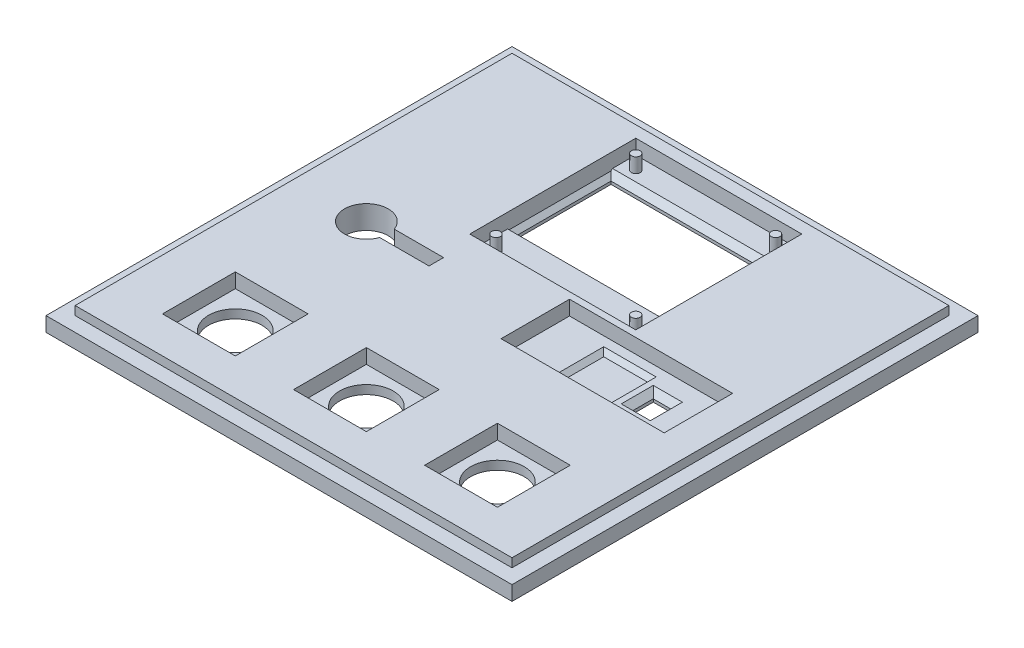
from build123d import *

# Parameters (mm, degrees)
SKETCH1_W           = 80
SKETCH1_H           = 80
SKETCH1_R           = 3.75
SKETCH1_R_2         = 4.596194078
SKETCH1_W_2         = 27
SKETCH1_H_2         = 16
SKETCH1_W_3         = 3
SKETCH1_H_3         = 3.5
BOSS_EXTRUDE1_DEPTH = 2.5
SKETCH2_W           = 75
SKETCH2_H           = 75
SKETCH2_R           = 3.75
SKETCH2_R_2         = 4.596194078
SKETCH2_W_2         = 27
SKETCH2_H_2         = 16
SKETCH2_W_3         = 3
SKETCH2_H_3         = 3.5
BOSS_EXTRUDE2_DEPTH = 1.5
SKETCH3_W           = 28
SKETCH3_H           = 11.75
SKETCH3_W_2         = 12.5
SKETCH3_H_2         = 12.5
SKETCH3_W_3         = 28.5
SKETCH3_H_3         = 28.5
SKETCH3_R           = 0.75
SKETCH3_W_4         = 12
SKETCH3_H_4         = 2.5
CUT_EXTRUDE1_DEPTH  = 2.5
CUT_EXTRUDE2_DEPTH  = 1
CHAMFER1_SIZE       = 1
SKETCH6_W           = 7
SKETCH6_H           = 6.5
CUT_EXTRUDE3_DEPTH  = 0.75
CHAMFER2_SIZE       = 1


with BuildPart() as part:
    # Sketch1 → Boss-Extrude1 (new body)
    with BuildSketch(Plane(origin=(0, 0, 0), x_dir=(1, 0, 0), z_dir=(0, 1, 0))):
        Rectangle(SKETCH1_W, SKETCH1_H)
        with Locations(Location((-25, 0, 0), (0, 0, 270))):
            Circle(SKETCH1_R, mode=Mode.SUBTRACT)
        with Locations(Location((-22.5, -25, 0), (0, 0, 270))):
            Circle(SKETCH1_R_2, mode=Mode.SUBTRACT)
        with Locations(Location((0, -25, 0), (0, 0, 270))):
            Circle(SKETCH1_R_2, mode=Mode.SUBTRACT)
        with Locations(Location((22.5, -25, 0), (0, 0, 270))):
            Circle(SKETCH1_R_2, mode=Mode.SUBTRACT)
        with Locations((0, 22.5)):
            Rectangle(SKETCH1_W_2, SKETCH1_H_2, mode=Mode.SUBTRACT)
        with Locations((24, 0)):
            Rectangle(SKETCH1_W_3, SKETCH1_H_3, mode=Mode.SUBTRACT)
    extrude(amount=BOSS_EXTRUDE1_DEPTH)

    # Sketch2 → Boss-Extrude2 (add)
    with BuildSketch(Plane(origin=(0, 2.5, 0), x_dir=(1, 0, 0), z_dir=(0, 1, 0))):
        Rectangle(SKETCH2_W, SKETCH2_H)
        with Locations(Location((-25, 0, 0), (0, 0, 270))):
            Circle(SKETCH2_R, mode=Mode.SUBTRACT)
        with Locations(Location((-22.5, -25, 0), (0, 0, 270))):
            Circle(SKETCH2_R_2, mode=Mode.SUBTRACT)
        with Locations(Location((0, -25, 0), (0, 0, 270))):
            Circle(SKETCH2_R_2, mode=Mode.SUBTRACT)
        with Locations(Location((22.5, -25, 0), (0, 0, 270))):
            Circle(SKETCH2_R_2, mode=Mode.SUBTRACT)
        with Locations((0, 22.5)):
            Rectangle(SKETCH2_W_2, SKETCH2_H_2, mode=Mode.SUBTRACT)
        with Locations((24, 0)):
            Rectangle(SKETCH2_W_3, SKETCH2_H_3, mode=Mode.SUBTRACT)
    extrude(amount=BOSS_EXTRUDE2_DEPTH)

    # Sketch3 → Cut-Extrude1 (cut)
    # profile 1 of 6: a face of its own
    with BuildSketch(Plane(origin=(0, 4, 0), x_dir=(1, 0, 0), z_dir=(0, 1, 0))):
        with Locations((18, 0)):
            Rectangle(SKETCH3_W, SKETCH3_H)
    # profile 2 of 6: a face of its own
    with BuildSketch(Plane(origin=(0, 4, 0), x_dir=(1, 0, 0), z_dir=(0, 1, 0))):
        with Locations((-22.5, -25)):
            Rectangle(SKETCH3_W_2, SKETCH3_H_2)
    # profile 3 of 6: a face of its own
    with BuildSketch(Plane(origin=(0, 4, 0), x_dir=(1, 0, 0), z_dir=(0, 1, 0))):
        with Locations((0, -25)):
            Rectangle(SKETCH3_W_2, SKETCH3_H_2)
    # profile 4 of 6: a face of its own
    with BuildSketch(Plane(origin=(0, 4, 0), x_dir=(1, 0, 0), z_dir=(0, 1, 0))):
        with Locations((22.5, -25)):
            Rectangle(SKETCH3_W_2, SKETCH3_H_2)
    # profile 5 of 6: a face of its own
    with BuildSketch(Plane(origin=(0, 4, 0), x_dir=(1, 0, 0), z_dir=(0, 1, 0))):
        with Locations((0, 21.25)):
            Rectangle(SKETCH3_W_3, SKETCH3_H_3)
        with Locations(Location((-12, 9.25, 0), (0, 0, 270))):
            Circle(SKETCH3_R, mode=Mode.SUBTRACT)
        with Locations(Location((12, 9.25, 0), (0, 0, 270))):
            Circle(SKETCH3_R, mode=Mode.SUBTRACT)
        with Locations(Location((-12, 33.25, 0), (0, 0, 270))):
            Circle(SKETCH3_R, mode=Mode.SUBTRACT)
        with Locations(Location((12, 33.25, 0), (0, 0, 270))):
            Circle(SKETCH3_R, mode=Mode.SUBTRACT)
    # profile 6 of 6: a face of its own
    with BuildSketch(Plane(origin=(0, 4, 0), x_dir=(1, 0, 0), z_dir=(0, 1, 0))):
        with Locations((-19, 0)):
            Rectangle(SKETCH3_W_4, SKETCH3_H_4)
    extrude(amount=-CUT_EXTRUDE1_DEPTH, mode=Mode.SUBTRACT)

    # Sketch5 → Cut-Extrude2 (cut)
    # profile 1 of 5: a face of its own
    with BuildSketch(Plane.XZ):
        with BuildLine():
            Line((-15.314102564, -2.557692308), (-15.942307692, -2.557692308))
            Line((-15.942307692, -2.557692308), (-15.942307692, -2.287059295))
            add(Edge.make_bspline(
                [(-15.942307692, -2.287059295), (-15.978134031, -2.314958038), (-16.046605128, -2.368277961), (-16.150986474, -2.435975666), (-16.248840247, -2.492583724), (-16.343712499, -2.534614816), (-16.436313118, -2.565395384), (-16.528921348, -2.586075922), (-16.62218654, -2.600367954), (-16.684976457, -2.601832446), (-16.716346154, -2.602564103)],
                knots=[0, 0, 0, 0, 1.276368674, 2.439388659, 3.495912974, 4.452193402, 5.352134101, 6.235408687, 7.118414254, 8, 8, 8, 8], degree=3))
            add(Edge.make_bspline(
                [(-16.716346154, -2.602564103), (-16.748178142, -2.601809409), (-16.810698204, -2.600327142), (-16.902404818, -2.587043105), (-16.99057064, -2.567039103), (-17.07513869, -2.538068223), (-17.15621812, -2.500755276), (-17.233306129, -2.454929083), (-17.307134386, -2.401512942), (-17.351969159, -2.359992411), (-17.374699519, -2.338942308)],
                knots=[0, 0, 0, 0, 1.049021809, 2.060345963, 3.049166385, 4.026358373, 5.002121295, 5.98669893, 6.979295433, 8, 8, 8, 8], degree=3))
            add(Edge.make_bspline(
                [(-17.374699519, -2.338942308), (-17.392972531, -2.319502791), (-17.42965229, -2.280481484), (-17.475774893, -2.21369225), (-17.515598123, -2.140745861), (-17.547550669, -2.060898672), (-17.571982399, -1.974090325), (-17.590246783, -1.881055684), (-17.600637768, -1.781085742), (-17.601910024, -1.712396906), (-17.602564103, -1.677083333)],
                knots=[0, 0, 0, 0, 0.889614892, 1.785740703, 2.700456201, 3.659579934, 4.649837014, 5.707163549, 6.821231365, 8, 8, 8, 8], degree=3))
            Line((-17.602564103, -1.677083333), (-17.602564103, 0))
            Line((-17.602564103, 0), (-16.974358974, 0))
            Line((-16.974358974, 0), (-16.974358974, -1.110576923))
            add(Edge.make_bspline(
                [(-16.974358974, -1.110576923), (-16.974226188, -1.14680202), (-16.973971729, -1.216220696), (-16.972016224, -1.315569051), (-16.968202384, -1.405294212), (-16.964714871, -1.485556568), (-16.95791194, -1.55608045), (-16.951647107, -1.617512877), (-16.942370319, -1.669148113), (-16.929936208, -1.724588981), (-16.90880149, -1.783718085), (-16.874626157, -1.845301855), (-16.833914764, -1.899274805), (-16.783944009, -1.942854804), (-16.727377165, -1.978137551), (-16.663470588, -2.001153711), (-16.594171646, -2.016847932), (-16.545835494, -2.018416281), (-16.520733173, -2.019230769)],
                knots=[0, 0, 0, 0, 1.498094087, 2.87081926, 4.108872756, 5.212198849, 6.192223846, 7.038608387, 7.76476505, 8.360237201, 9.387450647, 10.347786011, 11.264120523, 12.167881173, 13.074582735, 14.004426592, 14.963642712, 16, 16, 16, 16], degree=3))
            add(Edge.make_bspline(
                [(-16.520733173, -2.019230769), (-16.488116509, -2.017536931), (-16.424085854, -2.014211711), (-16.331564274, -1.990284891), (-16.247268941, -1.948098182), (-16.170368906, -1.891760394), (-16.102754082, -1.820620125), (-16.047460403, -1.735567725), (-16.001536006, -1.639279009), (-15.981912792, -1.569021262), (-15.971754808, -1.532652244)],
                knots=[0, 0, 0, 0, 0.983921966, 1.931563801, 2.858832989, 3.812360937, 4.795068995, 5.802394485, 6.86240651, 8, 8, 8, 8], degree=3))
            add(Edge.make_bspline(
                [(-15.971754808, -1.532652244), (-15.969230168, -1.521232268), (-15.963599715, -1.495763426), (-15.958903521, -1.452740988), (-15.952725138, -1.40142979), (-15.94892552, -1.341519455), (-15.946256799, -1.272787523), (-15.944218898, -1.195655081), (-15.942812408, -1.109646938), (-15.942481504, -1.049579945), (-15.942307692, -1.018028846)],
                knots=[0, 0, 0, 0, 0.543349587, 1.211778823, 2.009659055, 2.946304759, 4.001087888, 5.207523181, 6.533209197, 8, 8, 8, 8], degree=3))
            Line((-15.942307692, -1.018028846), (-15.942307692, 0))
            Line((-15.942307692, 0), (-15.314102564, 0))
            Line((-15.314102564, 0), (-15.314102564, -2.557692308))
        make_face()
    # profile 2 of 5: a face of its own
    with BuildSketch(Plane.XZ):
        with BuildLine():
            add(Edge.make_bspline(
                [(-12.785857372, -3.58974359), (-12.846709465, -3.588168661), (-12.966845279, -3.585059395), (-13.143516451, -3.559121692), (-13.31379221, -3.516908566), (-13.477696964, -3.457985839), (-13.634671717, -3.381675624), (-13.785293236, -3.289020183), (-13.929148756, -3.179233296), (-14.064561067, -3.053881628), (-14.188730842, -2.916813501), (-14.297877484, -2.770679131), (-14.390529149, -2.616987295), (-14.465734729, -2.455708046), (-14.524464863, -2.287062919), (-14.565281616, -2.110987913), (-14.59159929, -1.927708499), (-14.594619093, -1.802909648), (-14.596153846, -1.739483173)],
                knots=[0, 0, 0, 0, 1.014151002, 2.002163778, 2.969868608, 3.93493411, 4.9003771, 5.874719092, 6.87846472, 7.912488755, 8.947011879, 9.957751389, 10.948740761, 11.933621513, 12.919426746, 13.920294397, 14.943031967, 16, 16, 16, 16], degree=3))
            add(Edge.make_bspline(
                [(-14.596153846, -1.739483173), (-14.594518884, -1.676771488), (-14.591297139, -1.553196101), (-14.566359201, -1.37160396), (-14.524833041, -1.197421404), (-14.467235154, -1.030588885), (-14.393344559, -0.871103667), (-14.302107864, -0.719483262), (-14.194124498, -0.575416136), (-14.071600255, -0.4397849), (-13.93754387, -0.315871291), (-13.794709216, -0.207090364), (-13.6444233, -0.115595563), (-13.487646322, -0.039652914), (-13.32289927, 0.017415825), (-13.152008681, 0.060131946), (-12.973545007, 0.084832759), (-12.852304558, 0.088090183), (-12.790765224, 0.08974359)],
                knots=[0, 0, 0, 0, 1.051517626, 2.07204922, 3.067438659, 4.05042616, 5.027204762, 6.009981242, 7.012629434, 8.042243656, 9.071350414, 10.070091277, 11.048190212, 12.017682766, 12.985867053, 13.966945899, 14.968060614, 16, 16, 16, 16], degree=3))
            add(Edge.make_bspline(
                [(-12.790765224, 0.08974359), (-12.726397479, 0.08827779), (-12.599923657, 0.085397695), (-12.414782707, 0.058240346), (-12.237654486, 0.016835351), (-12.069024328, -0.043109119), (-11.909023326, -0.120998612), (-11.756933941, -0.215044231), (-11.613900023, -0.327062596), (-11.480398344, -0.453675043), (-11.359459588, -0.592252759), (-11.252703732, -0.738638503), (-11.162653723, -0.891725246), (-11.089304937, -1.051581713), (-11.031479761, -1.217215196), (-10.990690654, -1.38963425), (-10.966595559, -1.568425406), (-10.963239252, -1.689863931), (-10.961538462, -1.751402244)],
                knots=[0, 0, 0, 0, 1.067953136, 2.098381936, 3.099641766, 4.083805132, 5.062469929, 6.048665414, 7.046702845, 8.073106546, 9.098695993, 10.09591865, 11.076726721, 12.041940862, 13.011263376, 13.984305721, 14.978557872, 16, 16, 16, 16], degree=3))
            add(Edge.make_bspline(
                [(-10.961538462, -1.751402244), (-10.962079632, -1.792800204), (-10.963155121, -1.875071932), (-10.975826061, -1.99702608), (-10.994618614, -2.116425047), (-11.020345168, -2.233493361), (-11.055007391, -2.347929328), (-11.097136507, -2.460021607), (-11.146230207, -2.569769578), (-11.202843778, -2.676180726), (-11.266885023, -2.777981899), (-11.335263794, -2.876062234), (-11.410599142, -2.967846929), (-11.491336112, -3.054332991), (-11.577790944, -3.135125073), (-11.670114208, -3.210499044), (-11.768160591, -3.28026266), (-11.870869588, -3.344992407), (-11.977889857, -3.40168561), (-12.086675185, -3.453073846), (-12.198269896, -3.494739415), (-12.311863739, -3.529248151), (-12.427195551, -3.556942813), (-12.545155794, -3.575357402), (-12.664748912, -3.588128444), (-12.74539208, -3.58920393), (-12.785857372, -3.58974359)],
                knots=[0, 0, 0, 0, 1.034641744, 2.056182551, 3.061960284, 4.05571729, 5.050247014, 6.048716841, 7.047801973, 8.054190544, 9.059424999, 10.053182006, 11.041513076, 12.025412457, 13.009311837, 13.997642908, 15.002928308, 16.016213968, 17.030509951, 18.02913364, 19.022134519, 20.005478534, 20.996155877, 21.984625117, 22.988721131, 24, 24, 24, 24], degree=3))
        make_face()
        with BuildLine():
            add(Edge.make_bspline(
                [(-12.776041667, -2.961538462), (-12.735088422, -2.960439593), (-12.654263106, -2.958270865), (-12.535707053, -2.941748135), (-12.421889185, -2.915359354), (-12.313439829, -2.877135893), (-12.209891216, -2.828485819), (-12.111051332, -2.769585006), (-12.018320954, -2.69838629), (-11.930339991, -2.618797241), (-11.851131694, -2.529750419), (-11.779912706, -2.435361289), (-11.722329264, -2.333358687), (-11.672815725, -2.227102306), (-11.636242317, -2.113905032), (-11.608395482, -1.995604049), (-11.593228255, -1.870984913), (-11.590921693, -1.786262006), (-11.58974359, -1.742988782)],
                knots=[0, 0, 0, 0, 1.033668485, 2.040047952, 3.016132939, 3.979056467, 4.937231767, 5.900589077, 6.877725736, 7.88429546, 8.891280164, 9.882584218, 10.863295226, 11.842887319, 12.837417301, 13.860812229, 14.907384602, 16, 16, 16, 16], degree=3))
            add(Edge.make_bspline(
                [(-11.58974359, -1.742988782), (-11.591175632, -1.695018961), (-11.593982198, -1.601006059), (-11.613442255, -1.463789053), (-11.647540066, -1.334350302), (-11.694121786, -1.21225679), (-11.756042178, -1.0987924), (-11.830100365, -0.992581566), (-11.918150602, -0.894283273), (-11.985864586, -0.836844817), (-12.020232372, -0.807692308)],
                knots=[0, 0, 0, 0, 1.078343132, 2.113373867, 3.107373148, 4.082093053, 5.043582658, 6.005574554, 6.987742499, 8, 8, 8, 8], degree=3))
            add(Edge.make_bspline(
                [(-12.020232372, -0.807692308), (-12.04839365, -0.786158968), (-12.104081729, -0.743577439), (-12.192972027, -0.689000474), (-12.28451153, -0.642222571), (-12.37939102, -0.604426578), (-12.477410114, -0.574696886), (-12.578555373, -0.553877671), (-12.682683481, -0.540811814), (-12.753099788, -0.539250196), (-12.788661859, -0.538461538)],
                knots=[0, 0, 0, 0, 1.023928204, 2.024787132, 3.009472467, 3.9914905, 4.972207045, 5.96565515, 6.972602802, 8, 8, 8, 8], degree=3))
            add(Edge.make_bspline(
                [(-12.788661859, -0.538461538), (-12.828910132, -0.539571297), (-12.908099876, -0.541754781), (-13.024460068, -0.558051655), (-13.135884959, -0.585752546), (-13.243407338, -0.623369353), (-13.3455874, -0.67378239), (-13.444018568, -0.733644005), (-13.537527711, -0.804821153), (-13.624974892, -0.886415912), (-13.705115559, -0.975466934), (-13.776017746, -1.070366605), (-13.834736446, -1.17111862), (-13.883715316, -1.276377149), (-13.921875309, -1.38698027), (-13.94799029, -1.502936326), (-13.964773888, -1.623777487), (-13.966877208, -1.706006218), (-13.967948718, -1.747896635)],
                knots=[0, 0, 0, 0, 1.026350473, 2.019376834, 2.989435443, 3.95094063, 4.91865229, 5.889827372, 6.885283771, 7.910196595, 8.935871797, 9.9372888, 10.925850568, 11.904605667, 12.894245083, 13.903507864, 14.931967858, 16, 16, 16, 16], degree=3))
            add(Edge.make_bspline(
                [(-13.967948718, -1.747896635), (-13.966844284, -1.789547888), (-13.964670375, -1.871532028), (-13.948282174, -1.992037961), (-13.921037347, -2.107356876), (-13.882531699, -2.217786038), (-13.834561674, -2.32390519), (-13.774303337, -2.42479331), (-13.703062818, -2.520363111), (-13.622142452, -2.610046419), (-13.534080095, -2.692465159), (-13.439532536, -2.763988235), (-13.341149846, -2.826139881), (-13.236673462, -2.874826882), (-13.12824119, -2.913615736), (-13.01519129, -2.942180398), (-12.897095598, -2.958154796), (-12.816752657, -2.960400519), (-12.776041667, -2.961538462)],
                knots=[0, 0, 0, 0, 1.055040155, 2.076685641, 3.074845078, 4.052329834, 5.035358467, 6.020382375, 7.023447318, 8.050688466, 9.077178457, 10.074336316, 11.0503314, 12.019748348, 12.988025369, 13.964577102, 14.968620271, 16, 16, 16, 16], degree=3))
        make_face(mode=Mode.SUBTRACT)
    # profile 3 of 5: a face of its own
    with BuildSketch(Plane.XZ):
        with BuildLine():
            Line((-25, 7.442307692), (-25.224358974, 7.442307692))
            add(Edge.make_bspline(
                [(-25.224358974, 7.442307692), (-25.224508908, 7.401641821), (-25.224792412, 7.324748186), (-25.226466739, 7.215845408), (-25.22759582, 7.120016025), (-25.229612608, 7.037274777), (-25.232451022, 6.967864027), (-25.235360696, 6.911787569), (-25.237540238, 6.868691593), (-25.240613101, 6.844474699), (-25.241887019, 6.834435096)],
                knots=[0, 0, 0, 0, 1.604323161, 3.033556972, 4.296844687, 5.385167547, 6.298701784, 7.037230881, 7.60086462, 8, 8, 8, 8], degree=3))
            add(Edge.make_bspline(
                [(-25.241887019, 6.834435096), (-25.247860573, 6.799990486), (-25.25950505, 6.732846283), (-25.298052031, 6.639260863), (-25.354063902, 6.557737247), (-25.413439923, 6.500193569), (-25.468466273, 6.460909957), (-25.514628808, 6.435252425), (-25.564822153, 6.413256076), (-25.619208482, 6.396008303), (-25.677270544, 6.381919077), (-25.73963493, 6.372124946), (-25.805959488, 6.366727521), (-25.851619688, 6.365839385), (-25.875, 6.365384615)],
                knots=[0, 0, 0, 0, 1.43722947, 2.801646624, 4.13175475, 5.486897933, 6.18427957, 6.91287343, 7.658885333, 8.438447905, 9.260561323, 10.118602268, 11.036630026, 12, 12, 12, 12], degree=3))
            add(Edge.make_bspline(
                [(-25.875, 6.365384615), (-25.910825312, 6.36648546), (-25.985211087, 6.368771196), (-26.09979743, 6.387835353), (-26.221483496, 6.416335542), (-26.303569163, 6.443262376), (-26.346153846, 6.457231571)],
                knots=[0, 0, 0, 0, 0.891295899, 1.85063944, 2.884947376, 4, 4, 4, 4], degree=3))
            Line((-26.346153846, 6.457231571), (-26.346153846, 6.945913462))
            add(Edge.make_bspline(
                [(-26.346153846, 6.945913462), (-26.323310362, 6.939597623), (-26.279742732, 6.927551908), (-26.217055815, 6.914180094), (-26.160573002, 6.905923032), (-26.125089225, 6.904508516), (-26.108473558, 6.903846154)],
                knots=[0, 0, 0, 0, 1.174725213, 2.24046353, 3.176077791, 4, 4, 4, 4], degree=3))
            add(Edge.make_bspline(
                [(-26.108473558, 6.903846154), (-26.090157753, 6.904111672), (-26.055790437, 6.904609885), (-26.008686118, 6.915266025), (-25.967606159, 6.928427809), (-25.946633026, 6.945050865), (-25.936698718, 6.952924679)],
                knots=[0, 0, 0, 0, 1.200739268, 2.253036902, 3.172518975, 4, 4, 4, 4], degree=3))
            add(Edge.make_bspline(
                [(-25.936698718, 6.952924679), (-25.930324371, 6.960569078), (-25.916400842, 6.97726679), (-25.905774682, 7.012637512), (-25.897849275, 7.056060741), (-25.897582077, 7.088644446), (-25.897435897, 7.106470353)],
                knots=[0, 0, 0, 0, 0.730107156, 1.594778094, 2.684150175, 4, 4, 4, 4], degree=3))
            Line((-25.897435897, 7.106470353), (-25.895332532, 7.442307692))
            Line((-25.895332532, 7.442307692), (-26.301282051, 7.442307692))
            Line((-26.301282051, 7.442307692), (-26.301282051, 7.980769231))
            Line((-26.301282051, 7.980769231), (-25.852564103, 7.980769231))
            Line((-25.852564103, 7.980769231), (-25.852564103, 10))
            Line((-25.852564103, 10), (-25.224358974, 10))
            Line((-25.224358974, 10), (-25.224358974, 7.980769231))
            Line((-25.224358974, 7.980769231), (-25, 7.980769231))
            Line((-25, 7.980769231), (-25, 7.442307692))
        make_face()
    # profile 4 of 5: a face of its own
    with BuildSketch(Plane.XZ):
        with BuildLine():
            Line((-23.653846154, 7.442307692), (-23.878205128, 7.442307692))
            add(Edge.make_bspline(
                [(-23.878205128, 7.442307692), (-23.878355062, 7.401641821), (-23.878638566, 7.324748186), (-23.880312893, 7.215845408), (-23.881441974, 7.120016025), (-23.883458762, 7.037274777), (-23.886297176, 6.967864027), (-23.88920685, 6.911787569), (-23.891386391, 6.868691593), (-23.894459255, 6.844474699), (-23.895733173, 6.834435096)],
                knots=[0, 0, 0, 0, 1.604323161, 3.033556972, 4.296844687, 5.385167547, 6.298701784, 7.037230881, 7.60086462, 8, 8, 8, 8], degree=3))
            add(Edge.make_bspline(
                [(-23.895733173, 6.834435096), (-23.901706727, 6.799990486), (-23.913351204, 6.732846283), (-23.951898185, 6.639260863), (-24.007910056, 6.557737247), (-24.067286077, 6.500193569), (-24.122312427, 6.460909957), (-24.168474962, 6.435252425), (-24.218668307, 6.413256076), (-24.273054636, 6.396008303), (-24.331116698, 6.381919077), (-24.393481084, 6.372124946), (-24.459805642, 6.366727521), (-24.505465842, 6.365839385), (-24.528846154, 6.365384615)],
                knots=[0, 0, 0, 0, 1.43722947, 2.801646624, 4.13175475, 5.486897933, 6.18427957, 6.91287343, 7.658885333, 8.438447905, 9.260561323, 10.118602268, 11.036630026, 12, 12, 12, 12], degree=3))
            add(Edge.make_bspline(
                [(-24.528846154, 6.365384615), (-24.564671466, 6.36648546), (-24.639057241, 6.368771196), (-24.753643583, 6.387835353), (-24.87532965, 6.416335542), (-24.957415317, 6.443262376), (-25, 6.457231571)],
                knots=[0, 0, 0, 0, 0.891295899, 1.85063944, 2.884947376, 4, 4, 4, 4], degree=3))
            Line((-25, 6.457231571), (-25, 6.945913462))
            add(Edge.make_bspline(
                [(-25, 6.945913462), (-24.977156516, 6.939597623), (-24.933588886, 6.927551908), (-24.870901969, 6.914180094), (-24.814419156, 6.905923032), (-24.778935379, 6.904508516), (-24.762319712, 6.903846154)],
                knots=[0, 0, 0, 0, 1.174725213, 2.24046353, 3.176077791, 4, 4, 4, 4], degree=3))
            add(Edge.make_bspline(
                [(-24.762319712, 6.903846154), (-24.744003906, 6.904111672), (-24.709636591, 6.904609885), (-24.662532272, 6.915266025), (-24.621452313, 6.928427809), (-24.60047918, 6.945050865), (-24.590544872, 6.952924679)],
                knots=[0, 0, 0, 0, 1.200739268, 2.253036902, 3.172518975, 4, 4, 4, 4], degree=3))
            add(Edge.make_bspline(
                [(-24.590544872, 6.952924679), (-24.584170525, 6.960569078), (-24.570246996, 6.97726679), (-24.559620836, 7.012637512), (-24.551695429, 7.056060741), (-24.55142823, 7.088644446), (-24.551282051, 7.106470353)],
                knots=[0, 0, 0, 0, 0.730107156, 1.594778094, 2.684150175, 4, 4, 4, 4], degree=3))
            Line((-24.551282051, 7.106470353), (-24.549178686, 7.442307692))
            Line((-24.549178686, 7.442307692), (-24.955128205, 7.442307692))
            Line((-24.955128205, 7.442307692), (-24.955128205, 7.980769231))
            Line((-24.955128205, 7.980769231), (-24.506410256, 7.980769231))
            Line((-24.506410256, 7.980769231), (-24.506410256, 10))
            Line((-24.506410256, 10), (-23.878205128, 10))
            Line((-23.878205128, 10), (-23.878205128, 7.980769231))
            Line((-23.878205128, 7.980769231), (-23.653846154, 7.980769231))
            Line((-23.653846154, 7.980769231), (-23.653846154, 7.442307692))
        make_face()
    # profile 5 of 5: a face of its own
    with BuildSketch(Plane.XZ):
        with BuildLine():
            add(Edge.make_bspline(
                [(-21.6640625, 6.41025641), (-21.724914593, 6.411831339), (-21.845050408, 6.414940605), (-22.021721579, 6.440878308), (-22.191997338, 6.483091434), (-22.355902092, 6.542014161), (-22.512876845, 6.618324376), (-22.663498364, 6.710979817), (-22.807353884, 6.820766704), (-22.942766196, 6.946118372), (-23.06693597, 7.083186499), (-23.176082613, 7.229320869), (-23.268734277, 7.383012705), (-23.343939857, 7.544291954), (-23.402669991, 7.712937081), (-23.443486744, 7.889012087), (-23.469804418, 8.072291501), (-23.472824221, 8.197090352), (-23.474358974, 8.260516827)],
                knots=[0, 0, 0, 0, 1.014151002, 2.002163778, 2.969868608, 3.93493411, 4.9003771, 5.874719092, 6.87846472, 7.912488755, 8.947011879, 9.957751389, 10.948740761, 11.933621513, 12.919426746, 13.920294397, 14.943031967, 16, 16, 16, 16], degree=3))
            add(Edge.make_bspline(
                [(-23.474358974, 8.260516827), (-23.472724012, 8.323228512), (-23.469502267, 8.446803899), (-23.444564329, 8.62839604), (-23.403038169, 8.802578596), (-23.345440282, 8.969411115), (-23.271549687, 9.128896333), (-23.180312992, 9.280516738), (-23.072329626, 9.424583864), (-22.949805383, 9.5602151), (-22.815748999, 9.684128709), (-22.672914344, 9.792909636), (-22.522628428, 9.884404437), (-22.36585145, 9.960347086), (-22.201104398, 10.017415825), (-22.030213809, 10.060131946), (-21.851750135, 10.084832759), (-21.730509686, 10.088090183), (-21.668970353, 10.08974359)],
                knots=[0, 0, 0, 0, 1.051517626, 2.07204922, 3.067438659, 4.05042616, 5.027204762, 6.009981242, 7.012629434, 8.042243656, 9.071350414, 10.070091277, 11.048190212, 12.017682766, 12.985867053, 13.966945899, 14.968060614, 16, 16, 16, 16], degree=3))
            add(Edge.make_bspline(
                [(-21.668970353, 10.08974359), (-21.604602607, 10.08827779), (-21.478128785, 10.085397695), (-21.292987836, 10.058240346), (-21.115859614, 10.016835351), (-20.947229457, 9.956890881), (-20.787228454, 9.879001388), (-20.63513907, 9.784955769), (-20.492105151, 9.672937404), (-20.358603472, 9.546324957), (-20.237664716, 9.407747241), (-20.13090886, 9.261361497), (-20.040858851, 9.108274754), (-19.967510065, 8.948418287), (-19.909684889, 8.782784804), (-19.868895782, 8.61036575), (-19.844800687, 8.431574594), (-19.84144438, 8.310136069), (-19.83974359, 8.248597756)],
                knots=[0, 0, 0, 0, 1.067953136, 2.098381936, 3.099641766, 4.083805132, 5.062469929, 6.048665414, 7.046702845, 8.073106546, 9.098695993, 10.09591865, 11.076726721, 12.041940862, 13.011263376, 13.984305721, 14.978557872, 16, 16, 16, 16], degree=3))
            add(Edge.make_bspline(
                [(-19.83974359, 8.248597756), (-19.84028476, 8.207199796), (-19.841360249, 8.124928068), (-19.854031189, 8.00297392), (-19.872823742, 7.883574953), (-19.898550296, 7.766506639), (-19.933212519, 7.652070672), (-19.975341635, 7.539978393), (-20.024435335, 7.430230422), (-20.081048907, 7.323819274), (-20.145090152, 7.222018101), (-20.213468923, 7.123937766), (-20.28880427, 7.032153071), (-20.36954124, 6.945667009), (-20.455996072, 6.864874927), (-20.548319337, 6.789500956), (-20.646365719, 6.71973734), (-20.749074716, 6.655007593), (-20.856094985, 6.59831439), (-20.964880313, 6.546926154), (-21.076475025, 6.505260585), (-21.190068867, 6.470751849), (-21.305400679, 6.443057187), (-21.423360923, 6.424642598), (-21.54295404, 6.411871556), (-21.623597208, 6.41079607), (-21.6640625, 6.41025641)],
                knots=[0, 0, 0, 0, 1.034641744, 2.056182551, 3.061960284, 4.05571729, 5.050247014, 6.048716841, 7.047801973, 8.054190544, 9.059424999, 10.053182006, 11.041513076, 12.025412457, 13.009311837, 13.997642908, 15.002928308, 16.016213968, 17.030509951, 18.02913364, 19.022134519, 20.005478534, 20.996155877, 21.984625117, 22.988721131, 24, 24, 24, 24], degree=3))
        make_face()
        with BuildLine():
            add(Edge.make_bspline(
                [(-21.654246795, 7.038461538), (-21.613293551, 7.039560407), (-21.532468234, 7.041729135), (-21.413912181, 7.058251865), (-21.300094313, 7.084640646), (-21.191644958, 7.122864107), (-21.088096344, 7.171514181), (-20.98925646, 7.230414994), (-20.896526082, 7.30161371), (-20.808545119, 7.381202759), (-20.729336823, 7.470249581), (-20.658117835, 7.564638711), (-20.600534392, 7.666641313), (-20.551020853, 7.772897694), (-20.514447446, 7.886094968), (-20.48660061, 8.004395951), (-20.471433383, 8.129015087), (-20.469126822, 8.213737994), (-20.467948718, 8.257011218)],
                knots=[0, 0, 0, 0, 1.033668485, 2.040047952, 3.016132939, 3.979056467, 4.937231767, 5.900589077, 6.877725736, 7.88429546, 8.891280164, 9.882584218, 10.863295226, 11.842887319, 12.837417301, 13.860812229, 14.907384602, 16, 16, 16, 16], degree=3))
            add(Edge.make_bspline(
                [(-20.467948718, 8.257011218), (-20.469380761, 8.304981039), (-20.472187327, 8.398993941), (-20.491647383, 8.536210947), (-20.525745195, 8.665649698), (-20.572326914, 8.78774321), (-20.634247306, 8.9012076), (-20.708305493, 9.007418434), (-20.79635573, 9.105716727), (-20.864069714, 9.163155183), (-20.8984375, 9.192307692)],
                knots=[0, 0, 0, 0, 1.078343132, 2.113373867, 3.107373148, 4.082093053, 5.043582658, 6.005574554, 6.987742499, 8, 8, 8, 8], degree=3))
            add(Edge.make_bspline(
                [(-20.8984375, 9.192307692), (-20.926598779, 9.213841032), (-20.982286857, 9.256422561), (-21.071177155, 9.310999526), (-21.162716658, 9.357777429), (-21.257596148, 9.395573422), (-21.355615242, 9.425303114), (-21.456760501, 9.446122329), (-21.560888609, 9.459188186), (-21.631304916, 9.460749804), (-21.666866987, 9.461538462)],
                knots=[0, 0, 0, 0, 1.023928204, 2.024787132, 3.009472467, 3.9914905, 4.972207045, 5.96565515, 6.972602802, 8, 8, 8, 8], degree=3))
            add(Edge.make_bspline(
                [(-21.666866987, 9.461538462), (-21.70711526, 9.460428703), (-21.786305004, 9.458245219), (-21.902665196, 9.441948345), (-22.014090087, 9.414247454), (-22.121612466, 9.376630647), (-22.223792529, 9.32621761), (-22.322223696, 9.266355995), (-22.415732839, 9.195178847), (-22.50318002, 9.113584088), (-22.583320687, 9.024533066), (-22.654222875, 8.929633395), (-22.712941574, 8.82888138), (-22.761920444, 8.723622851), (-22.800080437, 8.61301973), (-22.826195418, 8.497063674), (-22.842979016, 8.376222513), (-22.845082336, 8.293993782), (-22.846153846, 8.252103365)],
                knots=[0, 0, 0, 0, 1.026350473, 2.019376834, 2.989435443, 3.95094063, 4.91865229, 5.889827372, 6.885283771, 7.910196595, 8.935871797, 9.9372888, 10.925850568, 11.904605667, 12.894245083, 13.903507864, 14.931967858, 16, 16, 16, 16], degree=3))
            add(Edge.make_bspline(
                [(-22.846153846, 8.252103365), (-22.845049412, 8.210452112), (-22.842875503, 8.128467972), (-22.826487302, 8.007962039), (-22.799242475, 7.892643124), (-22.760736827, 7.782213962), (-22.712766803, 7.67609481), (-22.652508465, 7.57520669), (-22.581267946, 7.479636889), (-22.50034758, 7.389953581), (-22.412285223, 7.307534841), (-22.317737664, 7.236011765), (-22.219354975, 7.173860119), (-22.11487859, 7.125173118), (-22.006446319, 7.086384264), (-21.893396418, 7.057819602), (-21.775300726, 7.041845204), (-21.694957785, 7.039599481), (-21.654246795, 7.038461538)],
                knots=[0, 0, 0, 0, 1.055040155, 2.076685641, 3.074845078, 4.052329834, 5.035358467, 6.020382375, 7.023447318, 8.050688466, 9.077178457, 10.074336316, 11.0503314, 12.019748348, 12.988025369, 13.964577102, 14.968620271, 16, 16, 16, 16], degree=3))
        make_face(mode=Mode.SUBTRACT)
    extrude(amount=-CUT_EXTRUDE2_DEPTH, mode=Mode.SUBTRACT)

    # Chamfer1
    # the kernel refuses this chamfer: 1 mm, written as the material it takes off along each edge
    with BuildSketch(Plane(origin=(25.5, 1.5, 1.75), x_dir=(0, -0.9996219169112968, -0.02749587661058627), z_dir=(-1, 0, 0)), Plane(origin=(22.5, 1.5, -1.75), x_dir=(0, -0.9996219169112968, 0.02749587661058627), z_dir=(1, 0, 0))) as chamfer1_piece_1:
        Polygon((CHAMFER1_SIZE * 0.999621916911, CHAMFER1_SIZE * 0.0274958766106), (-CHAMFER1_SIZE * 0.0274958766106, CHAMFER1_SIZE * 0.999621916911), (0, 0), align=None)
    extrude(amount=3, mode=Mode.SUBTRACT)
    with BuildSketch(Plane(origin=(-13.5, 1.5, -14.5), x_dir=(0, -0.9996219169112968, -0.027495876610585623), z_dir=(1, 0, 0)), Plane(origin=(13.5, 1.5, -30.5), x_dir=(0, -0.9996219169112968, 0.027495876610585623), z_dir=(-1, 0, 0))) as chamfer1_piece_2:
        Polygon((CHAMFER1_SIZE * 0.999621916911, -CHAMFER1_SIZE * 0.0274958766106), (-CHAMFER1_SIZE * 0.0274958766106, -CHAMFER1_SIZE * 0.999621916911), (0, 0), align=None)
    extrude(amount=27, mode=Mode.SUBTRACT)
    with BuildSketch(Plane(origin=(13.5, 1.5, -14.5), x_dir=(-0.027495876610583895, -0.9996219169112968, 0), z_dir=(0, 0, -1))) as chamfer1_piece_3_section:
        Polygon((CHAMFER1_SIZE * 0.999621916911, -CHAMFER1_SIZE * 0.0274958766106), (-CHAMFER1_SIZE * 0.0274958766106, -CHAMFER1_SIZE * 0.999621916911), (0, 0), align=None)
    chamfer1_piece_3 = extrude(amount=16, mode=Mode.PRIVATE)
    chamfer1_piece_3 = split(chamfer1_piece_3, bisect_by=Plane(origin=(14.25, 1.14804089, -22.5), z_dir=(-1, 0, 0)), keep=Keep.TOP, mode=Mode.PRIVATE)
    add(chamfer1_piece_3, mode=Mode.SUBTRACT)
    with BuildSketch(Plane(origin=(-13.5, 1.5, -30.5), x_dir=(0.027495876610585623, -0.9996219169112968, 0), z_dir=(0, 0, 1))) as chamfer1_piece_4_section:
        Polygon((CHAMFER1_SIZE * 0.999621916911, -CHAMFER1_SIZE * 0.0274958766106), (-CHAMFER1_SIZE * 0.0274958766106, -CHAMFER1_SIZE * 0.999621916911), (0, 0), align=None)
    chamfer1_piece_4 = extrude(amount=16, mode=Mode.PRIVATE)
    chamfer1_piece_4 = split(chamfer1_piece_4, bisect_by=Plane(origin=(-14.25, 1.14804089, -22.5), z_dir=(1, 0, 0)), keep=Keep.TOP, mode=Mode.PRIVATE)
    add(chamfer1_piece_4, mode=Mode.SUBTRACT)
    with BuildSketch(Plane(origin=(25.5, 1.5, -1.75), x_dir=(-0.027495876610585623, -0.9996219169112968, 0), z_dir=(0, 0, 1)), Plane(origin=(22.5, 1.5, 1.75), x_dir=(0.027495876610585623, -0.9996219169112968, 0), z_dir=(0, 0, -1))) as chamfer1_piece_5:
        Polygon((CHAMFER1_SIZE * 0.999621916911, CHAMFER1_SIZE * 0.0274958766106), (-CHAMFER1_SIZE * 0.0274958766106, CHAMFER1_SIZE * 0.999621916911), (0, 0), align=None)
    extrude(amount=3.5, mode=Mode.SUBTRACT)
    with BuildSketch(Plane(origin=(25.5, 1.5, -1.75), x_dir=(-0.027495876610585623, -0.9996219169112968, 0), z_dir=(0, 0, 1))) as chamfer1_piece_6a_section:
        Polygon((CHAMFER1_SIZE * 0.999621916911, CHAMFER1_SIZE * 0.0274958766106), (-CHAMFER1_SIZE * 0.0274958766106, CHAMFER1_SIZE * 0.999621916911), (0, 0), align=None)
    chamfer1_piece_6a = extrude(amount=6.071682988, mode=Mode.PRIVATE)
    chamfer1_piece_6a = split(chamfer1_piece_6a, bisect_by=Plane(origin=(25.829793627, 1.170206373, 1.75), z_dir=(0, 0, 1)), keep=Keep.TOP, mode=Mode.PRIVATE)
    with BuildSketch(Plane(origin=(28.071682988, 1.5, 1.75), x_dir=(0, -0.9996219169112968, -0.02749587661058627), z_dir=(-1, 0, 0))) as chamfer1_piece_6b_section:
        Polygon((CHAMFER1_SIZE * 0.999621916911, CHAMFER1_SIZE * 0.0274958766106), (-CHAMFER1_SIZE * 0.0274958766106, CHAMFER1_SIZE * 0.999621916911), (0, 0), align=None)
    chamfer1_piece_6b = extrude(amount=5.571682988, mode=Mode.PRIVATE)
    chamfer1_piece_6b = split(chamfer1_piece_6b, bisect_by=Plane(origin=(25.5, 1.170206373, 2.079793627), z_dir=(1, 0, 0)), keep=Keep.TOP, mode=Mode.PRIVATE)
    chamfer1_piece_6 = chamfer1_piece_6a & chamfer1_piece_6b
    add(chamfer1_piece_6, mode=Mode.SUBTRACT)
    with BuildSketch(Plane(origin=(22.5, 1.5, 4.321682988), x_dir=(0.027495876610585623, -0.9996219169112968, 0), z_dir=(0, 0, -1))) as chamfer1_piece_7a_section:
        Polygon((CHAMFER1_SIZE * 0.999621916911, CHAMFER1_SIZE * 0.0274958766106), (-CHAMFER1_SIZE * 0.0274958766106, CHAMFER1_SIZE * 0.999621916911), (0, 0), align=None)
    chamfer1_piece_7a = extrude(amount=6.071682988, mode=Mode.PRIVATE)
    chamfer1_piece_7a = split(chamfer1_piece_7a, bisect_by=Plane(origin=(22.170206373, 1.170206373, 1.75), z_dir=(0, 0, 1)), keep=Keep.TOP, mode=Mode.PRIVATE)
    with BuildSketch(Plane(origin=(25.5, 1.5, 1.75), x_dir=(0, -0.9996219169112968, -0.02749587661058627), z_dir=(-1, 0, 0))) as chamfer1_piece_7b_section:
        Polygon((CHAMFER1_SIZE * 0.999621916911, CHAMFER1_SIZE * 0.0274958766106), (-CHAMFER1_SIZE * 0.0274958766106, CHAMFER1_SIZE * 0.999621916911), (0, 0), align=None)
    chamfer1_piece_7b = extrude(amount=5.571682988, mode=Mode.PRIVATE)
    chamfer1_piece_7b = split(chamfer1_piece_7b, bisect_by=Plane(origin=(22.5, 1.170206373, 2.079793627), z_dir=(-1, 0, 0)), keep=Keep.TOP, mode=Mode.PRIVATE)
    chamfer1_piece_7 = chamfer1_piece_7a & chamfer1_piece_7b
    add(chamfer1_piece_7, mode=Mode.SUBTRACT)
    with BuildSketch(Plane(origin=(-13.5, 1.5, -30.5), x_dir=(0.027495876610585623, -0.9996219169112968, 0), z_dir=(0, 0, 1))) as chamfer1_piece_8a_section:
        Polygon((CHAMFER1_SIZE * 0.999621916911, -CHAMFER1_SIZE * 0.0274958766106), (-CHAMFER1_SIZE * 0.0274958766106, -CHAMFER1_SIZE * 0.999621916911), (0, 0), align=None)
    chamfer1_piece_8a = extrude(amount=18.571682988, mode=Mode.PRIVATE)
    chamfer1_piece_8a = split(chamfer1_piece_8a, bisect_by=Plane(origin=(-13.787486413, 1.14804089, -14.5), z_dir=(0, 0, 1)), keep=Keep.TOP, mode=Mode.PRIVATE)
    chamfer1_piece_8a = split(chamfer1_piece_8a, bisect_by=Plane(origin=(-14.25, 1.14804089, -13.214158506), z_dir=(1, 0, 0)), keep=Keep.TOP, mode=Mode.PRIVATE)
    with BuildSketch(Plane(origin=(-16.071682988, 1.5, -14.5), x_dir=(0, -0.9996219169112968, -0.027495876610585623), z_dir=(1, 0, 0))) as chamfer1_piece_8b_section:
        Polygon((CHAMFER1_SIZE * 0.999621916911, -CHAMFER1_SIZE * 0.0274958766106), (-CHAMFER1_SIZE * 0.0274958766106, -CHAMFER1_SIZE * 0.999621916911), (0, 0), align=None)
    chamfer1_piece_8b = extrude(amount=29.571682988, mode=Mode.PRIVATE)
    chamfer1_piece_8b = split(chamfer1_piece_8b, bisect_by=Plane(origin=(-13.5, 1.170206373, -14.170206373), z_dir=(-1, 0, 0)), keep=Keep.TOP, mode=Mode.PRIVATE)
    chamfer1_piece_8b = split(chamfer1_piece_8b, bisect_by=Plane(origin=(-14.25, 1.170206373, -14.170206373), z_dir=(1, 0, 0)), keep=Keep.TOP, mode=Mode.PRIVATE)
    chamfer1_piece_8 = chamfer1_piece_8a & chamfer1_piece_8b
    add(chamfer1_piece_8, mode=Mode.SUBTRACT)
    with BuildSketch(Plane(origin=(13.5, 1.5, -11.928317012), x_dir=(-0.027495876610585623, -0.9996219169112968, 0), z_dir=(0, 0, -1))) as chamfer1_piece_9a_section:
        Polygon((CHAMFER1_SIZE * 0.999621916911, -CHAMFER1_SIZE * 0.0274958766106), (-CHAMFER1_SIZE * 0.0274958766106, -CHAMFER1_SIZE * 0.999621916911), (0, 0), align=None)
    chamfer1_piece_9a = extrude(amount=18.571682988, mode=Mode.PRIVATE)
    chamfer1_piece_9a = split(chamfer1_piece_9a, bisect_by=Plane(origin=(13.787486413, 1.14804089, -14.5), z_dir=(0, 0, 1)), keep=Keep.TOP, mode=Mode.PRIVATE)
    chamfer1_piece_9a = split(chamfer1_piece_9a, bisect_by=Plane(origin=(14.25, 1.14804089, -13.214158506), z_dir=(-1, 0, 0)), keep=Keep.TOP, mode=Mode.PRIVATE)
    with BuildSketch(Plane(origin=(-13.5, 1.5, -14.5), x_dir=(0, -0.9996219169112968, -0.027495876610585623), z_dir=(1, 0, 0))) as chamfer1_piece_9b_section:
        Polygon((CHAMFER1_SIZE * 0.999621916911, -CHAMFER1_SIZE * 0.0274958766106), (-CHAMFER1_SIZE * 0.0274958766106, -CHAMFER1_SIZE * 0.999621916911), (0, 0), align=None)
    chamfer1_piece_9b = extrude(amount=29.571682988, mode=Mode.PRIVATE)
    chamfer1_piece_9b = split(chamfer1_piece_9b, bisect_by=Plane(origin=(13.5, 1.170206373, -14.170206373), z_dir=(1, 0, 0)), keep=Keep.TOP, mode=Mode.PRIVATE)
    chamfer1_piece_9b = split(chamfer1_piece_9b, bisect_by=Plane(origin=(14.25, 1.170206373, -14.170206373), z_dir=(-1, 0, 0)), keep=Keep.TOP, mode=Mode.PRIVATE)
    chamfer1_piece_9 = chamfer1_piece_9a & chamfer1_piece_9b
    add(chamfer1_piece_9, mode=Mode.SUBTRACT)
    with BuildSketch(Plane(origin=(16.071682988, 1.5, -30.5), x_dir=(0, -0.9996219169112968, 0.027495876610585623), z_dir=(-1, 0, 0))) as chamfer1_piece_10a_section:
        Polygon((CHAMFER1_SIZE * 0.999621916911, -CHAMFER1_SIZE * 0.0274958766106), (-CHAMFER1_SIZE * 0.0274958766106, -CHAMFER1_SIZE * 0.999621916911), (0, 0), align=None)
    chamfer1_piece_10a = extrude(amount=29.571682988, mode=Mode.PRIVATE)
    chamfer1_piece_10a = split(chamfer1_piece_10a, bisect_by=Plane(origin=(13.5, 1.170206373, -30.829793627), z_dir=(1, 0, 0)), keep=Keep.TOP, mode=Mode.PRIVATE)
    chamfer1_piece_10a = split(chamfer1_piece_10a, bisect_by=Plane(origin=(14.25, 1.170206373, -30.829793627), z_dir=(-1, 0, 0)), keep=Keep.TOP, mode=Mode.PRIVATE)
    with BuildSketch(Plane(origin=(13.5, 1.5, -14.5), x_dir=(-0.027495876610583895, -0.9996219169112968, 0), z_dir=(0, 0, -1))) as chamfer1_piece_10b_section:
        Polygon((CHAMFER1_SIZE * 0.999621916911, -CHAMFER1_SIZE * 0.0274958766106), (-CHAMFER1_SIZE * 0.0274958766106, -CHAMFER1_SIZE * 0.999621916911), (0, 0), align=None)
    chamfer1_piece_10b = extrude(amount=18.571682988, mode=Mode.PRIVATE)
    chamfer1_piece_10b = split(chamfer1_piece_10b, bisect_by=Plane(origin=(13.787486413, 1.14804089, -30.5), z_dir=(0, 0, -1)), keep=Keep.TOP, mode=Mode.PRIVATE)
    chamfer1_piece_10b = split(chamfer1_piece_10b, bisect_by=Plane(origin=(14.25, 1.14804089, -31.785841494), z_dir=(-1, 0, 0)), keep=Keep.TOP, mode=Mode.PRIVATE)
    chamfer1_piece_10 = chamfer1_piece_10a & chamfer1_piece_10b
    add(chamfer1_piece_10, mode=Mode.SUBTRACT)
    with BuildSketch(Plane(origin=(13.5, 1.5, -30.5), x_dir=(0, -0.9996219169112968, 0.027495876610585623), z_dir=(-1, 0, 0))) as chamfer1_piece_11a_section:
        Polygon((CHAMFER1_SIZE * 0.999621916911, -CHAMFER1_SIZE * 0.0274958766106), (-CHAMFER1_SIZE * 0.0274958766106, -CHAMFER1_SIZE * 0.999621916911), (0, 0), align=None)
    chamfer1_piece_11a = extrude(amount=29.571682988, mode=Mode.PRIVATE)
    chamfer1_piece_11a = split(chamfer1_piece_11a, bisect_by=Plane(origin=(-13.5, 1.170206373, -30.829793627), z_dir=(-1, 0, 0)), keep=Keep.TOP, mode=Mode.PRIVATE)
    chamfer1_piece_11a = split(chamfer1_piece_11a, bisect_by=Plane(origin=(-14.25, 1.170206373, -30.829793627), z_dir=(1, 0, 0)), keep=Keep.TOP, mode=Mode.PRIVATE)
    with BuildSketch(Plane(origin=(-13.5, 1.5, -33.071682988), x_dir=(0.027495876610585623, -0.9996219169112968, 0), z_dir=(0, 0, 1))) as chamfer1_piece_11b_section:
        Polygon((CHAMFER1_SIZE * 0.999621916911, -CHAMFER1_SIZE * 0.0274958766106), (-CHAMFER1_SIZE * 0.0274958766106, -CHAMFER1_SIZE * 0.999621916911), (0, 0), align=None)
    chamfer1_piece_11b = extrude(amount=18.571682988, mode=Mode.PRIVATE)
    chamfer1_piece_11b = split(chamfer1_piece_11b, bisect_by=Plane(origin=(-13.787486413, 1.14804089, -30.5), z_dir=(0, 0, -1)), keep=Keep.TOP, mode=Mode.PRIVATE)
    chamfer1_piece_11b = split(chamfer1_piece_11b, bisect_by=Plane(origin=(-14.25, 1.14804089, -31.785841494), z_dir=(1, 0, 0)), keep=Keep.TOP, mode=Mode.PRIVATE)
    chamfer1_piece_11 = chamfer1_piece_11a & chamfer1_piece_11b
    add(chamfer1_piece_11, mode=Mode.SUBTRACT)
    with BuildSketch(Plane(origin=(19.928317012, 1.5, -1.75), x_dir=(0, -0.9996219169112968, 0.02749587661058627), z_dir=(1, 0, 0))) as chamfer1_piece_12a_section:
        Polygon((CHAMFER1_SIZE * 0.999621916911, CHAMFER1_SIZE * 0.0274958766106), (-CHAMFER1_SIZE * 0.0274958766106, CHAMFER1_SIZE * 0.999621916911), (0, 0), align=None)
    chamfer1_piece_12a = extrude(amount=5.571682988, mode=Mode.PRIVATE)
    chamfer1_piece_12a = split(chamfer1_piece_12a, bisect_by=Plane(origin=(22.5, 1.170206373, -2.079793627), z_dir=(-1, 0, 0)), keep=Keep.TOP, mode=Mode.PRIVATE)
    with BuildSketch(Plane(origin=(22.5, 1.5, 1.75), x_dir=(0.027495876610585623, -0.9996219169112968, 0), z_dir=(0, 0, -1))) as chamfer1_piece_12b_section:
        Polygon((CHAMFER1_SIZE * 0.999621916911, CHAMFER1_SIZE * 0.0274958766106), (-CHAMFER1_SIZE * 0.0274958766106, CHAMFER1_SIZE * 0.999621916911), (0, 0), align=None)
    chamfer1_piece_12b = extrude(amount=6.071682988, mode=Mode.PRIVATE)
    chamfer1_piece_12b = split(chamfer1_piece_12b, bisect_by=Plane(origin=(22.170206373, 1.170206373, -1.75), z_dir=(0, 0, -1)), keep=Keep.TOP, mode=Mode.PRIVATE)
    chamfer1_piece_12 = chamfer1_piece_12a & chamfer1_piece_12b
    add(chamfer1_piece_12, mode=Mode.SUBTRACT)
    with BuildSketch(Plane(origin=(22.5, 1.5, -1.75), x_dir=(0, -0.9996219169112968, 0.02749587661058627), z_dir=(1, 0, 0))) as chamfer1_piece_13a_section:
        Polygon((CHAMFER1_SIZE * 0.999621916911, CHAMFER1_SIZE * 0.0274958766106), (-CHAMFER1_SIZE * 0.0274958766106, CHAMFER1_SIZE * 0.999621916911), (0, 0), align=None)
    chamfer1_piece_13a = extrude(amount=5.571682988, mode=Mode.PRIVATE)
    chamfer1_piece_13a = split(chamfer1_piece_13a, bisect_by=Plane(origin=(25.5, 1.170206373, -2.079793627), z_dir=(1, 0, 0)), keep=Keep.TOP, mode=Mode.PRIVATE)
    with BuildSketch(Plane(origin=(25.5, 1.5, -4.321682988), x_dir=(-0.027495876610585623, -0.9996219169112968, 0), z_dir=(0, 0, 1))) as chamfer1_piece_13b_section:
        Polygon((CHAMFER1_SIZE * 0.999621916911, CHAMFER1_SIZE * 0.0274958766106), (-CHAMFER1_SIZE * 0.0274958766106, CHAMFER1_SIZE * 0.999621916911), (0, 0), align=None)
    chamfer1_piece_13b = extrude(amount=6.071682988, mode=Mode.PRIVATE)
    chamfer1_piece_13b = split(chamfer1_piece_13b, bisect_by=Plane(origin=(25.829793627, 1.170206373, -1.75), z_dir=(0, 0, -1)), keep=Keep.TOP, mode=Mode.PRIVATE)
    chamfer1_piece_13 = chamfer1_piece_13a & chamfer1_piece_13b
    add(chamfer1_piece_13, mode=Mode.SUBTRACT)

    # Sketch6 → Cut-Extrude3 (cut)
    with BuildSketch(Plane(origin=(0, 1.5, 0), x_dir=(1, 0, 0), z_dir=(0, 1, 0))):
        with Locations((16, 0)):
            Rectangle(SKETCH6_W, SKETCH6_H)
    extrude(amount=-CUT_EXTRUDE3_DEPTH, mode=Mode.SUBTRACT)

    # Chamfer2
    # the kernel refuses this chamfer: 1 mm, written as the material it takes off along each edge
    with BuildSketch(Plane(origin=(12.5, 1.5, 3.25), x_dir=(0, 0.027495876610586282, 0.9996219169112968), z_dir=(1, 0, 0))) as chamfer2_piece_1_section:
        Polygon((CHAMFER2_SIZE * 0.999621916911, CHAMFER2_SIZE * 0.0274958766106), (-CHAMFER2_SIZE * 0.0274958766106, CHAMFER2_SIZE * 0.999621916911), (0, 0), align=None)
    chamfer2_piece_1 = extrude(amount=7, mode=Mode.PRIVATE)
    chamfer2_piece_1 = split(chamfer2_piece_1, bisect_by=Plane(origin=(16, 0.75, 3.60195911), z_dir=(0, 1, 0)), keep=Keep.TOP, mode=Mode.PRIVATE)
    add(chamfer2_piece_1, mode=Mode.SUBTRACT)
    with BuildSketch(Plane(origin=(12.5, 1.5, -3.25), x_dir=(-0.9996219169112968, 0.027495876610586296, 0), z_dir=(0, 0, 1))) as chamfer2_piece_2_section:
        Polygon((CHAMFER2_SIZE * 0.999621916911, CHAMFER2_SIZE * 0.0274958766106), (-CHAMFER2_SIZE * 0.0274958766106, CHAMFER2_SIZE * 0.999621916911), (0, 0), align=None)
    chamfer2_piece_2 = extrude(amount=6.5, mode=Mode.PRIVATE)
    chamfer2_piece_2 = split(chamfer2_piece_2, bisect_by=Plane(origin=(12.14804089, 0.75, 0), z_dir=(0, 1, 0)), keep=Keep.TOP, mode=Mode.PRIVATE)
    add(chamfer2_piece_2, mode=Mode.SUBTRACT)
    with BuildSketch(Plane(origin=(19.5, 1.5, -3.25), x_dir=(0, 0.027495876610586258, -0.9996219169112968), z_dir=(-1, 0, 0))) as chamfer2_piece_3_section:
        Polygon((CHAMFER2_SIZE * 0.999621916911, CHAMFER2_SIZE * 0.0274958766106), (-CHAMFER2_SIZE * 0.0274958766106, CHAMFER2_SIZE * 0.999621916911), (0, 0), align=None)
    chamfer2_piece_3 = extrude(amount=7, mode=Mode.PRIVATE)
    chamfer2_piece_3 = split(chamfer2_piece_3, bisect_by=Plane(origin=(16, 0.75, -3.60195911), z_dir=(0, 1, 0)), keep=Keep.TOP, mode=Mode.PRIVATE)
    add(chamfer2_piece_3, mode=Mode.SUBTRACT)
    with BuildSketch(Plane(origin=(19.5, 1.5, 3.25), x_dir=(0.9996219169112968, 0.027495876610586296, 0), z_dir=(0, 0, -1))) as chamfer2_piece_4_section:
        Polygon((CHAMFER2_SIZE * 0.999621916911, CHAMFER2_SIZE * 0.0274958766106), (-CHAMFER2_SIZE * 0.0274958766106, CHAMFER2_SIZE * 0.999621916911), (0, 0), align=None)
    chamfer2_piece_4 = extrude(amount=6.5, mode=Mode.PRIVATE)
    chamfer2_piece_4 = split(chamfer2_piece_4, bisect_by=Plane(origin=(19.85195911, 0.75, 0), z_dir=(0, 1, 0)), keep=Keep.TOP, mode=Mode.PRIVATE)
    add(chamfer2_piece_4, mode=Mode.SUBTRACT)
    with BuildSketch(Plane(origin=(9.928317012, 1.5, 3.25), x_dir=(0, 0.027495876610586282, 0.9996219169112968), z_dir=(1, 0, 0))) as chamfer2_piece_5a_section:
        Polygon((CHAMFER2_SIZE * 0.999621916911, CHAMFER2_SIZE * 0.0274958766106), (-CHAMFER2_SIZE * 0.0274958766106, CHAMFER2_SIZE * 0.999621916911), (0, 0), align=None)
    chamfer2_piece_5a = extrude(amount=9.571682988, mode=Mode.PRIVATE)
    chamfer2_piece_5a = split(chamfer2_piece_5a, bisect_by=Plane(origin=(12.5, 1.212513587, 3.60195911), z_dir=(-1, 0, 0)), keep=Keep.TOP, mode=Mode.PRIVATE)
    chamfer2_piece_5a = split(chamfer2_piece_5a, bisect_by=Plane(origin=(11.214158506, 0.75, 3.60195911), z_dir=(0, 1, 0)), keep=Keep.TOP, mode=Mode.PRIVATE)
    with BuildSketch(Plane(origin=(12.5, 1.5, -3.25), x_dir=(-0.9996219169112968, 0.027495876610586296, 0), z_dir=(0, 0, 1))) as chamfer2_piece_5b_section:
        Polygon((CHAMFER2_SIZE * 0.999621916911, CHAMFER2_SIZE * 0.0274958766106), (-CHAMFER2_SIZE * 0.0274958766106, CHAMFER2_SIZE * 0.999621916911), (0, 0), align=None)
    chamfer2_piece_5b = extrude(amount=9.071682988, mode=Mode.PRIVATE)
    chamfer2_piece_5b = split(chamfer2_piece_5b, bisect_by=Plane(origin=(12.14804089, 1.212513587, 3.25), z_dir=(0, 0, 1)), keep=Keep.TOP, mode=Mode.PRIVATE)
    chamfer2_piece_5b = split(chamfer2_piece_5b, bisect_by=Plane(origin=(12.14804089, 0.75, 4.535841494), z_dir=(0, 1, 0)), keep=Keep.TOP, mode=Mode.PRIVATE)
    chamfer2_piece_5 = chamfer2_piece_5a & chamfer2_piece_5b
    add(chamfer2_piece_5, mode=Mode.SUBTRACT)
    with BuildSketch(Plane(origin=(12.5, 1.5, 3.25), x_dir=(0, 0.027495876610586282, 0.9996219169112968), z_dir=(1, 0, 0))) as chamfer2_piece_6a_section:
        Polygon((CHAMFER2_SIZE * 0.999621916911, CHAMFER2_SIZE * 0.0274958766106), (-CHAMFER2_SIZE * 0.0274958766106, CHAMFER2_SIZE * 0.999621916911), (0, 0), align=None)
    chamfer2_piece_6a = extrude(amount=9.571682988, mode=Mode.PRIVATE)
    chamfer2_piece_6a = split(chamfer2_piece_6a, bisect_by=Plane(origin=(19.5, 1.212513587, 3.60195911), z_dir=(1, 0, 0)), keep=Keep.TOP, mode=Mode.PRIVATE)
    chamfer2_piece_6a = split(chamfer2_piece_6a, bisect_by=Plane(origin=(20.785841494, 0.75, 3.60195911), z_dir=(0, 1, 0)), keep=Keep.TOP, mode=Mode.PRIVATE)
    with BuildSketch(Plane(origin=(19.5, 1.5, 5.821682988), x_dir=(0.9996219169112968, 0.027495876610586296, 0), z_dir=(0, 0, -1))) as chamfer2_piece_6b_section:
        Polygon((CHAMFER2_SIZE * 0.999621916911, CHAMFER2_SIZE * 0.0274958766106), (-CHAMFER2_SIZE * 0.0274958766106, CHAMFER2_SIZE * 0.999621916911), (0, 0), align=None)
    chamfer2_piece_6b = extrude(amount=9.071682988, mode=Mode.PRIVATE)
    chamfer2_piece_6b = split(chamfer2_piece_6b, bisect_by=Plane(origin=(19.85195911, 1.212513587, 3.25), z_dir=(0, 0, 1)), keep=Keep.TOP, mode=Mode.PRIVATE)
    chamfer2_piece_6b = split(chamfer2_piece_6b, bisect_by=Plane(origin=(19.85195911, 0.75, 4.535841494), z_dir=(0, 1, 0)), keep=Keep.TOP, mode=Mode.PRIVATE)
    chamfer2_piece_6 = chamfer2_piece_6a & chamfer2_piece_6b
    add(chamfer2_piece_6, mode=Mode.SUBTRACT)
    with BuildSketch(Plane(origin=(19.5, 1.5, -3.25), x_dir=(0, 0.027495876610586258, -0.9996219169112968), z_dir=(-1, 0, 0))) as chamfer2_piece_7a_section:
        Polygon((CHAMFER2_SIZE * 0.999621916911, CHAMFER2_SIZE * 0.0274958766106), (-CHAMFER2_SIZE * 0.0274958766106, CHAMFER2_SIZE * 0.999621916911), (0, 0), align=None)
    chamfer2_piece_7a = extrude(amount=9.571682988, mode=Mode.PRIVATE)
    chamfer2_piece_7a = split(chamfer2_piece_7a, bisect_by=Plane(origin=(12.5, 1.212513587, -3.60195911), z_dir=(-1, 0, 0)), keep=Keep.TOP, mode=Mode.PRIVATE)
    chamfer2_piece_7a = split(chamfer2_piece_7a, bisect_by=Plane(origin=(11.214158506, 0.75, -3.60195911), z_dir=(0, 1, 0)), keep=Keep.TOP, mode=Mode.PRIVATE)
    with BuildSketch(Plane(origin=(12.5, 1.5, -5.821682988), x_dir=(-0.9996219169112968, 0.027495876610586296, 0), z_dir=(0, 0, 1))) as chamfer2_piece_7b_section:
        Polygon((CHAMFER2_SIZE * 0.999621916911, CHAMFER2_SIZE * 0.0274958766106), (-CHAMFER2_SIZE * 0.0274958766106, CHAMFER2_SIZE * 0.999621916911), (0, 0), align=None)
    chamfer2_piece_7b = extrude(amount=9.071682988, mode=Mode.PRIVATE)
    chamfer2_piece_7b = split(chamfer2_piece_7b, bisect_by=Plane(origin=(12.14804089, 1.212513587, -3.25), z_dir=(0, 0, -1)), keep=Keep.TOP, mode=Mode.PRIVATE)
    chamfer2_piece_7b = split(chamfer2_piece_7b, bisect_by=Plane(origin=(12.14804089, 0.75, -4.535841494), z_dir=(0, 1, 0)), keep=Keep.TOP, mode=Mode.PRIVATE)
    chamfer2_piece_7 = chamfer2_piece_7a & chamfer2_piece_7b
    add(chamfer2_piece_7, mode=Mode.SUBTRACT)
    with BuildSketch(Plane(origin=(19.5, 1.5, 3.25), x_dir=(0.9996219169112968, 0.027495876610586296, 0), z_dir=(0, 0, -1))) as chamfer2_piece_8a_section:
        Polygon((CHAMFER2_SIZE * 0.999621916911, CHAMFER2_SIZE * 0.0274958766106), (-CHAMFER2_SIZE * 0.0274958766106, CHAMFER2_SIZE * 0.999621916911), (0, 0), align=None)
    chamfer2_piece_8a = extrude(amount=9.071682988, mode=Mode.PRIVATE)
    chamfer2_piece_8a = split(chamfer2_piece_8a, bisect_by=Plane(origin=(19.85195911, 1.212513587, -3.25), z_dir=(0, 0, -1)), keep=Keep.TOP, mode=Mode.PRIVATE)
    chamfer2_piece_8a = split(chamfer2_piece_8a, bisect_by=Plane(origin=(19.85195911, 0.75, -4.535841494), z_dir=(0, 1, 0)), keep=Keep.TOP, mode=Mode.PRIVATE)
    with BuildSketch(Plane(origin=(22.071682988, 1.5, -3.25), x_dir=(0, 0.027495876610586258, -0.9996219169112968), z_dir=(-1, 0, 0))) as chamfer2_piece_8b_section:
        Polygon((CHAMFER2_SIZE * 0.999621916911, CHAMFER2_SIZE * 0.0274958766106), (-CHAMFER2_SIZE * 0.0274958766106, CHAMFER2_SIZE * 0.999621916911), (0, 0), align=None)
    chamfer2_piece_8b = extrude(amount=9.571682988, mode=Mode.PRIVATE)
    chamfer2_piece_8b = split(chamfer2_piece_8b, bisect_by=Plane(origin=(19.5, 1.212513587, -3.60195911), z_dir=(1, 0, 0)), keep=Keep.TOP, mode=Mode.PRIVATE)
    chamfer2_piece_8b = split(chamfer2_piece_8b, bisect_by=Plane(origin=(20.785841494, 0.75, -3.60195911), z_dir=(0, 1, 0)), keep=Keep.TOP, mode=Mode.PRIVATE)
    chamfer2_piece_8 = chamfer2_piece_8a & chamfer2_piece_8b
    add(chamfer2_piece_8, mode=Mode.SUBTRACT)


solid = part.part
